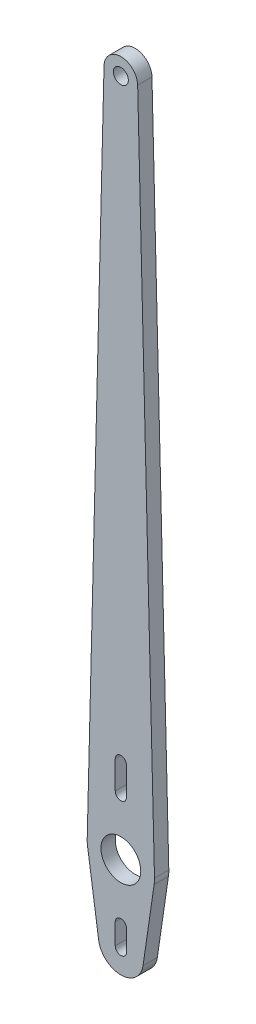
from build123d import *

# Parameters (mm, degrees)
MODEL_R             = 3.55
MODEL_R_2           = 1.333
BOSS_EXTRUDE1_DEPTH = 2.55


with BuildPart() as part:
    # Model → Boss-Extrude1 (new body)
    with BuildSketch(Plane.XY):
        with BuildLine():
            Line((-2.99907779, 121.074380165), (-5.99815558, 0.148760331))
            ThreePointArc((-5.99815558, 0.148760331), (-5.989087114, -0.361711962), (-5.936653631, -0.869565217))
            Line((-5.936653631, -0.869565217), (-3.957769087, -14.379710145))
            ThreePointArc((-3.957769087, -14.379710145), (0, -17.8), (3.957769087, -14.379710145))
            Line((3.957769087, -14.379710145), (5.936653631, -0.869565217))
            ThreePointArc((5.936653631, -0.869565217), (5.989087114, -0.361711962), (5.99815558, 0.148760331))
            Line((5.99815558, 0.148760331), (2.99907779, 121.074380165))
            ThreePointArc((2.99907779, 121.074380165), (0, 124), (-2.99907779, 121.074380165))
        make_face()
        Circle(MODEL_R, mode=Mode.SUBTRACT)
        with Locations((0, 121)):
            Circle(MODEL_R_2, mode=Mode.SUBTRACT)
        with BuildLine():
            Line((-1, -10.1), (-1, -13.8))
            ThreePointArc((-1, -13.8), (0, -14.8), (1, -13.8))
            Line((1, -13.8), (1, -10.1))
            ThreePointArc((1, -10.1), (0, -9.1), (-1, -10.1))
        make_face(mode=Mode.SUBTRACT)
        with BuildLine():
            Line((-1, 15.1), (-1, 10.1))
            ThreePointArc((-1, 10.1), (0, 9.1), (1, 10.1))
            Line((1, 10.1), (1, 15.1))
            ThreePointArc((1, 15.1), (0, 16.1), (-1, 15.1))
        make_face(mode=Mode.SUBTRACT)
    extrude(amount=BOSS_EXTRUDE1_DEPTH)


solid = part.part
